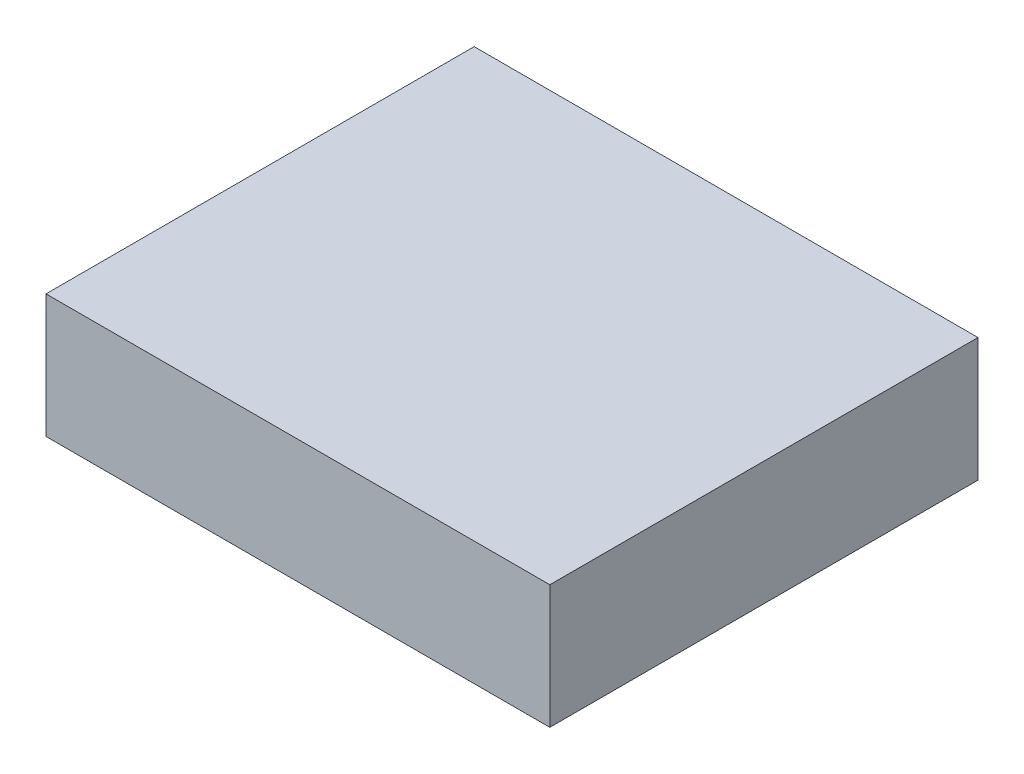
from build123d import *

# Parameters (mm, degrees)
SKETCH1_W           = 76.481149891
SKETCH1_H           = 65
BOSS_EXTRUDE1_DEPTH = 18.75


with BuildPart() as part:
    # Sketch1 → Boss-Extrude1 (new body)
    with BuildSketch(Plane(origin=(0, 0, 0), x_dir=(1, 0, 0), z_dir=(0, 1, 0))):
        with Locations((3.455975789, -1.25)):
            Rectangle(SKETCH1_W, SKETCH1_H)
    extrude(amount=BOSS_EXTRUDE1_DEPTH)


solid = part.part
